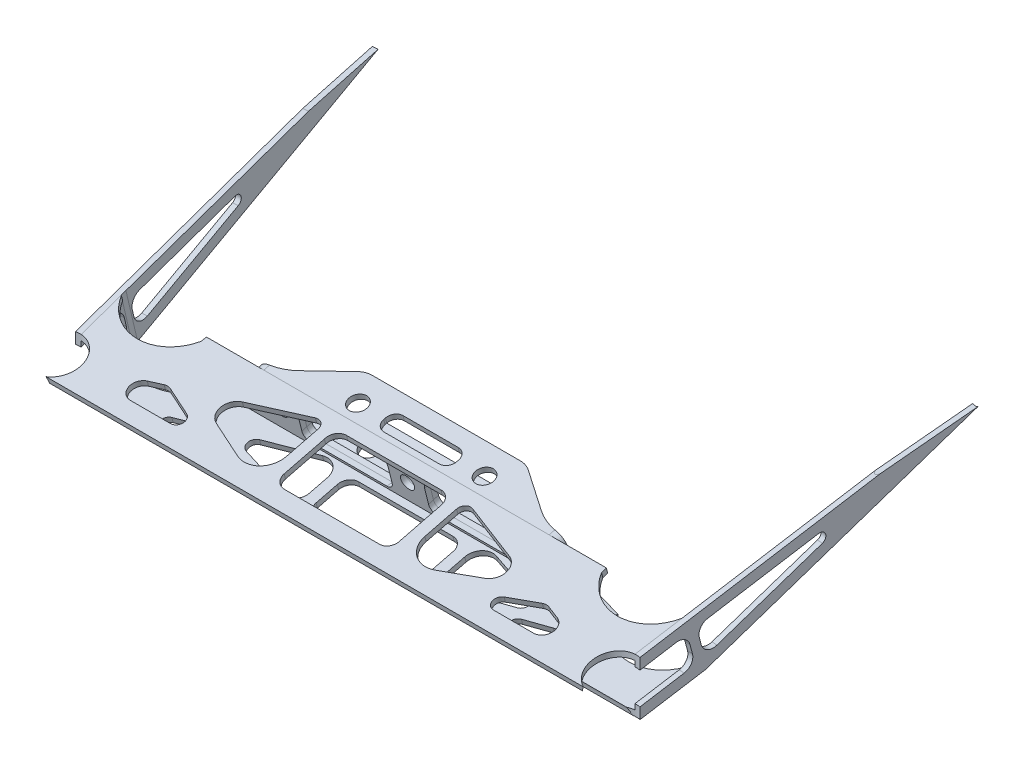
from build123d import *

# Parameters (mm, degrees)
BOSS_EXTRUDE12_DEPTH                       = 175
BOSS_EXTRUDE12_DEPTH_BACK                  = 175
SKETCH1_R                                  = 12.7
SKETCH1_R_2                                = 11.5
CUT_EXTRUDE2_DEPTH                         = 176.919242836
CUT_EXTRUDE2_DEPTH_BACK                    = 176.919242836
BOSS_EXTRUDE13_REACH                       = 284.778
SKETCH18_R                                 = 12.7
SKETCH18_R_2                               = 11.5
BOSS_EXTRUDE14_REACH                       = 556.697
SKETCH20_R                                 = 11.2
SKETCH20_R_2                               = 10
BOSS_EXTRUDE15_REACH                       = 435.706
BOSS_EXTRUDE15_END_RADIUS                  = 12.7
SKETCH21_R                                 = 12.7
SKETCH21_R_2                               = 11.5
BOSS_EXTRUDE15_DIRECTION_2_REACH           = 435.706
BOSS_EXTRUDE15_DIRECTION_2_END_RADIUS      = 12.7
BOSS_EXTRUDEMAINXMEMBER_DEPTH              = 165.85
BOSS_EXTRUDEMAINXMEMBER_DEPTH_BACK         = 165.85
SKETCH46_W                                 = 165.540939551
SKETCH46_H                                 = 112.162432512
CUT_EXTRUDE7_DEPTH                         = 529.248434774
BOSS_EXTRUDELOWERSHOCKMNT_START            = 11.62
SKETCH5_R                                  = 5
BOSS_EXTRUDELOWERSHOCKMNT_DEPTH            = 3
BOSS_EXTRUDEUPPERSHOCKMNT_START            = -11.65
SKETCH5_3_R                                = 5
BOSS_EXTRUDEUPPERSHOCKMNT_DEPTH            = 3
SKETCH40_R                                 = 4.1021
BOSS_EXTRUDEBASESHOCKMNT_DEPTH             = 3
FILLETSHOCKMNT_START                       = -23.714786314
FILLETSHOCKMNT_DEPTH                       = 2.922035421
FILLETSHOCKMNT_START_2                     = -47.109041572
FILLETSHOCKMNT_2_DEPTH                     = 0.124255258
FILLETSHOCKMNT_START_3                     = -20.839041572
FILLETSHOCKMNT_3_DEPTH                     = 0.054370147
FILLETSHOCKMNT_START_4                     = -49.984786314
FILLETSHOCKMNT_4_DEPTH                     = 2.875744742
FILLETSHOCKMNT_START_5                     = -20.784671425
FILLETSHOCKMNT_5_DEPTH                     = 0.069885111
FILLETSHOCKMNT_START_6                     = -20.792750893
FILLETSHOCKMNT_6_DEPTH                     = 0.008079468
FILLETSHOCKMNT_START_7                     = 38.86190522
FILLETSHOCKMNT_7_DEPTH                     = 4.928835609
BOSS_EXTRUDELEFTVERTTUBEGUSSET_DEPTH       = 1.5
CUT_EXTRUDELEFTVERTTUBEGUSSETLIGHTEN_DEPTH = 3
SKETCH20_3_R                               = 11.2
SKETCH20_3_R_2                             = 10
CUT_EXTRUDETRIMXMEMBERU_DEPTH              = 570.182555296
SKETCH18_2_R                               = 12.7
SKETCH18_2_R_2                             = 11.5
CUT_EXTRUDE6_DEPTH                         = 472.005588149
SKETCH26_R                                 = 4.1021
CUT_EXTRUDEXMEMBERREAR_DEPTH               = 3
CUT_EXTRUDEXMEMBERREAR_DRAFT               = -4
CUT_EXTRUDEXMEMBERREAR_PROFILE_2_DEPTH     = 3
CUT_EXTRUDEXMEMBERREAR_PROFILE_2_DRAFT     = -4
CUT_EXTRUDEXMEMBERREAR_PROFILE_3_DEPTH     = 3
CUT_EXTRUDEXMEMBERREAR_PROFILE_3_DRAFT     = -4
CUT_EXTRUDEXMEMBERREAR_PROFILE_4_DEPTH     = 3
CUT_EXTRUDEXMEMBERREAR_PROFILE_4_DRAFT     = -4
CUT_EXTRUDEXMEMBERREAR_PROFILE_5_DEPTH     = 3
CUT_EXTRUDEXMEMBERREAR_PROFILE_5_DRAFT     = -4
CUT_EXTRUDEXMEMBERREAR_PROFILE_6_DEPTH     = 3
CUT_EXTRUDEXMEMBERREAR_PROFILE_6_DRAFT     = -4
CUT_EXTRUDEXMEMBERREAR_PROFILE_7_DEPTH     = 3
CUT_EXTRUDEXMEMBERREAR_PROFILE_7_DRAFT     = -4
CUT_EXTRUDEXMEMBERBOTTOMDIAGS_DEPTH        = 3
CUTEXTRUDEXMEMBERTOPDIAGS_DEPTH            = 3
CUT_EXTRUDEBOTTOMCROSSTUBEFIT_DEPTH        = 263.587706398
CUT_EXTRUDEBOTTOMCROSSTUBEFIT_DEPTH_BACK   = 263.587706398
SKETCH35_R                                 = 12.7


with BuildPart() as part:
    # Sketch1 → Boss-Extrude12 (new, two sides: drawn at the far end of the back side and taken through both)
    with BuildSketch(Plane(origin=(0, 0, 0), x_dir=(0, 0, -1), z_dir=(1, 0, 0)).offset(-BOSS_EXTRUDE12_DEPTH_BACK)):
        Circle(SKETCH1_R)
        Circle(SKETCH1_R_2, mode=Mode.SUBTRACT)
    extrude(amount=BOSS_EXTRUDE12_DEPTH + BOSS_EXTRUDE12_DEPTH_BACK)

    # Sketch17 → Cut-Extrude2 (cut, two sides: drawn at the far end of the back side and taken through both)
    with BuildSketch(Plane.XY.offset(-CUT_EXTRUDE2_DEPTH_BACK)):
        Polygon((168.55, 12.7), (126.783029561, -29.066970439), (201.822655854, -29.066970439), (201.822655854, 12.7), align=None)
        Polygon((-168.55, 12.7), (-126.783029561, -29.066970439), (-201.822655854, -29.066970439), (-201.822655854, 12.7), align=None)
    extrude(amount=CUT_EXTRUDE2_DEPTH + CUT_EXTRUDE2_DEPTH_BACK, mode=Mode.SUBTRACT)

    # Sketch18 → Boss-Extrude13 (add, up to next)
    with BuildSketch(Plane(origin=(0, -214, 0), x_dir=(-1, 0, 0), z_dir=(0, -1, 0)), mode=Mode.PRIVATE) as boss_extrude13_sk1:
        with Locations(Location((-155.85, 0, 0), (0, 0, 180))):
            Circle(SKETCH18_R)
        with Locations(Location((-155.85, 0, 0), (0, 0, 180))):
            Circle(SKETCH18_R_2, mode=Mode.SUBTRACT)
    boss_extrude13_tool1 = extrude(boss_extrude13_sk1.sketch, amount=-BOSS_EXTRUDE13_REACH, mode=Mode.PRIVATE) - part.part
    # Sketch18 → Boss-Extrude13 (add, up to next)
    with BuildSketch(Plane(origin=(0, -214, 0), x_dir=(-1, 0, 0), z_dir=(0, -1, 0)), mode=Mode.PRIVATE) as boss_extrude13_sk2:
        with Locations(Location((155.85, 0, 0), (0, 0, 180))):
            Circle(SKETCH18_R)
        with Locations(Location((155.85, 0, 0), (0, 0, 180))):
            Circle(SKETCH18_R_2, mode=Mode.SUBTRACT)
    boss_extrude13_tool2 = extrude(boss_extrude13_sk2.sketch, amount=-BOSS_EXTRUDE13_REACH, mode=Mode.PRIVATE) - part.part
    add(boss_extrude13_tool1.solids().sort_by_distance((143.50921, -214, 0))[0])
    add(boss_extrude13_tool2.solids().sort_by_distance((-168.19079, -214, 0))[0])

    # Sketch20 → Boss-Extrude14 (add, up to next)
    with BuildSketch(Plane(origin=(180, 57, -323.098711697), x_dir=(0.9973018692485346, -0.012736517833004717, 0.07229635334419354), z_dir=(-0.07340968116659599, -0.17326508598327037, 0.982135544968325)), mode=Mode.PRIVATE) as boss_extrude14_sk1:
        with Locations(Location((0, 0, 0), (0, 0, 41.766987321))):
            Circle(SKETCH20_R)
        with Locations(Location((0, 0, 0), (0, 0, 41.074676503))):
            Circle(SKETCH20_R_2, mode=Mode.SUBTRACT)
    boss_extrude14_tool1 = extrude(boss_extrude14_sk1.sketch, amount=BOSS_EXTRUDE14_REACH, mode=Mode.PRIVATE) - part.part
    boss_extrude14 = boss_extrude14_tool1.solids().sort_by_distance((171.904673, 49.964287, -324.945014))[0]
    add(boss_extrude14)

    # Mirror5: Boss-Extrude14 across plane
    add(boss_extrude14.mirror(Plane(origin=(0, 0, 0), x_dir=(0, 0, 1), z_dir=(1, 0, 0))))

    # Boss-Extrude15: up to this cylinder (the profile starts outside it)
    boss_extrude15_end = Plane(origin=(155.85, -50, 0), z_dir=(0, -1, 0)) * Cylinder(BOSS_EXTRUDE15_END_RADIUS, 897.812, mode=Mode.PRIVATE)
    # Sketch21 → Boss-Extrude15 (add, up to the surface)
    with BuildSketch(Plane(origin=(0, 0, 0), x_dir=(0, 0, -1), z_dir=(1, 0, 0)), mode=Mode.PRIVATE) as boss_extrude15_sk1:
        with Locations((0, -50)):
            Circle(SKETCH21_R)
        with Locations((0, -50)):
            Circle(SKETCH21_R_2, mode=Mode.SUBTRACT)
    boss_extrude15_tool1 = extrude(boss_extrude15_sk1.sketch, amount=BOSS_EXTRUDE15_REACH, mode=Mode.PRIVATE) - boss_extrude15_end
    add(boss_extrude15_tool1.solids().sort_by_distance((0, -50, 12.34079))[0])

    # Boss-Extrude15 direction 2: up to this cylinder (the profile starts outside it)
    boss_extrude15_direction_2_end = Plane(origin=(-155.85, -50, 0), z_dir=(0, -1, 0)) * Cylinder(BOSS_EXTRUDE15_DIRECTION_2_END_RADIUS, 897.812, mode=Mode.PRIVATE)
    # Sketch21 → Boss-Extrude15 direction 2 (add, up to the surface)
    with BuildSketch(Plane(origin=(0, 0, 0), x_dir=(0, 0, -1), z_dir=(1, 0, 0)), mode=Mode.PRIVATE) as boss_extrude15_direction_2_sk1:
        with Locations((0, -50)):
            Circle(SKETCH21_R)
        with Locations((0, -50)):
            Circle(SKETCH21_R_2, mode=Mode.SUBTRACT)
    boss_extrude15_direction_2_tool1 = extrude(boss_extrude15_direction_2_sk1.sketch, amount=-BOSS_EXTRUDE15_DIRECTION_2_REACH, mode=Mode.PRIVATE) - boss_extrude15_direction_2_end
    add(boss_extrude15_direction_2_tool1.solids().sort_by_distance((0, -50, 12.34079))[0])


with BuildPart() as body_2:
    # Sketch2 → Boss-ExtrudeMainXmember (new, two sides: drawn at the far end of the back side and taken through both)
    with BuildSketch(Plane(origin=(0, 0, 0), x_dir=(0, 0, -1), z_dir=(1, 0, 0)).offset(-BOSS_EXTRUDEMAINXMEMBER_DEPTH_BACK)):
        Polygon((46.896325284, -39.85335332), (12.103461131, -48.528188653), (11.377695445, -45.617301474), (43.259672419, -37.668231828), (37.622892251, -15.060341406), (-10.891894063, -27.156436186), (-11.61765975, -24.245549007), (39.808013743, -11.42368854), align=None)
    extrude(amount=BOSS_EXTRUDEMAINXMEMBER_DEPTH + BOSS_EXTRUDEMAINXMEMBER_DEPTH_BACK)

    # Sketch46 → Cut-Extrude7 (cut, through all)
    with BuildSketch(Plane(origin=(154.984133263, 0, 11.584282706), x_dir=(-0.07453703703703697, 0, 0.997218245977148), z_dir=(-0.997218245977148, 0, -0.07453703703703697))):
        with Locations((-33.423089586, -22.597023813)):
            Rectangle(SKETCH46_W, SKETCH46_H)
    cut_extrude7 = extrude(amount=-CUT_EXTRUDE7_DEPTH, mode=Mode.SUBTRACT)

    # Mirror4: Cut-Extrude7 across plane
    add(cut_extrude7.mirror(Plane(origin=(0, 0, 0), x_dir=(0, 0, 1), z_dir=(1, 0, 0))), mode=Mode.SUBTRACT)

    # Sketch42 → Boss-ExtrudeLeftVertTubeGusset (add, symmetric)
    with BuildSketch(Plane(origin=(155.85, 0, 0), x_dir=(-0.07453703703703697, 0, 0.997218245977148), z_dir=(-0.997218245977148, 0, -0.07453703703703697))):
        Polygon((-193.050072711, 23.60587092), (14.485468375, -12.905011308), (4.541982888, -52.675213787), (-47.027143229, -39.85335332), align=None)
    boss_extrudeleftverttubegusset = extrude(amount=BOSS_EXTRUDELEFTVERTTUBEGUSSET_DEPTH, both=True)

    # Sketch45 → Cut-ExtrudeLeftVertTubeGussetLighten (cut)
    with BuildSketch(Plane(origin=(156.479960632, 0, 11.696088262), x_dir=(-0.0745370370370369, 0, 0.997218245977148), z_dir=(-0.997218245977148, 0, -0.0745370370370369))):
        Polygon((0.040031957, -24.219304243), (-345.10927195, 61.596697465), (-328.771481985, 127.306783252), (79.703640812, 25.745802428), (63.365850846, -39.964283359), align=None)
        with BuildLine():
            Line((-10.157134064, -27.867116711), (-43.174427901, -19.657880556))
            ThreePointArc((-43.174427901, -19.657880556), (-47.712381175, -20.337595354), (-50.442979665, -24.025259114))
            Line((-50.442979665, -24.025259114), (-51.729452386, -29.17066619))
            ThreePointArc((-51.729452386, -29.17066619), (-51.051635871, -33.716233033), (-47.356358542, -36.448729806))
            Line((-47.356358542, -36.448729806), (-14.339064705, -44.657965961))
            ThreePointArc((-14.339064705, -44.657965961), (-9.801111431, -43.978251163), (-7.07051294, -40.290587403))
            Line((-7.07051294, -40.290587403), (-5.784040219, -35.145180327))
            ThreePointArc((-5.784040219, -35.145180327), (-6.461856735, -30.599613484), (-10.157134064, -27.867116711))
        make_face()
        with BuildLine():
            Line((-59.679677528, -15.553604453), (-117.816183972, -1.098867098))
            ThreePointArc((-117.816183972, -1.098867098), (-121.381246102, -3.047109834), (-119.73576712, -6.76163762))
            Line((-119.73576712, -6.76163762), (-64.491614129, -30.769860883))
            ThreePointArc((-64.491614129, -30.769860883), (-59.447689366, -30.648891023), (-56.279353988, -26.722383457))
            Line((-56.279353988, -26.722383457), (-55.306583684, -22.83166807))
            ThreePointArc((-55.306583684, -22.83166807), (-55.984400199, -18.286101227), (-59.679677528, -15.553604453))
        make_face()
    cut_extrudeleftverttubegussetlighten = extrude(amount=CUT_EXTRUDELEFTVERTTUBEGUSSETLIGHTEN_DEPTH, mode=Mode.SUBTRACT)

    # Mirror3: Boss-ExtrudeLeftVertTubeGusset across plane
    add(boss_extrudeleftverttubegusset.mirror(Plane(origin=(0, 0, 0), x_dir=(0, 0, 1), z_dir=(1, 0, 0))))

    # Mirror3 2: Cut-ExtrudeLeftVertTubeGussetLighten across plane
    add(cut_extrudeleftverttubegussetlighten.mirror(Plane(origin=(0, 0, 0), x_dir=(0, 0, 1), z_dir=(1, 0, 0))), mode=Mode.SUBTRACT)

    # Sketch20<3> → Cut-ExtrudeTrimXmemberU (cut, through all)
    # profile 1 of 2: a face of its own
    with BuildSketch(Plane(origin=(180, 57, -323.098711697), x_dir=(0.9973018692485346, -0.012736517833004717, 0.07229635334419354), z_dir=(-0.07340968116659599, -0.17326508598327037, 0.982135544968325))):
        with Locations(Location((0, 0, 0), (0, 0, 41.766987321))):
            Circle(SKETCH20_3_R)
        with Locations(Location((0, 0, 0), (0, 0, 41.074676503))):
            Circle(SKETCH20_3_R_2, mode=Mode.SUBTRACT)
    # profile 2 of 2: a face of its own
    with BuildSketch(Plane(origin=(180, 57, -323.098711697), x_dir=(0.9973018692485346, -0.012736517833004717, 0.07229635334419354), z_dir=(-0.07340968116659599, -0.17326508598327037, 0.982135544968325))):
        with Locations((-359.028672929, 0.006280918)):
            Circle(SKETCH20_3_R)
        with Locations((-359.028672929, 0.006280918)):
            Circle(SKETCH20_3_R_2, mode=Mode.SUBTRACT)
    extrude(amount=CUT_EXTRUDETRIMXMEMBERU_DEPTH, mode=Mode.SUBTRACT)

    # Sketch18<2> → Cut-Extrude6 (cut, through all)
    # profile 1 of 2: a face of its own
    with BuildSketch(Plane(origin=(0, -214, 0), x_dir=(-1, 0, 0), z_dir=(0, -1, 0))):
        with Locations(Location((-155.85, 0, 0), (0, 0, 180))):
            Circle(SKETCH18_2_R)
        with Locations(Location((-155.85, 0, 0), (0, 0, 180))):
            Circle(SKETCH18_2_R_2, mode=Mode.SUBTRACT)
    # profile 2 of 2: a face of its own
    with BuildSketch(Plane(origin=(0, -214, 0), x_dir=(-1, 0, 0), z_dir=(0, -1, 0))):
        with Locations(Location((155.85, 0, 0), (0, 0, 180))):
            Circle(SKETCH18_2_R)
        with Locations(Location((155.85, 0, 0), (0, 0, 180))):
            Circle(SKETCH18_2_R_2, mode=Mode.SUBTRACT)
    extrude(amount=-CUT_EXTRUDE6_DEPTH, mode=Mode.SUBTRACT)


with BuildPart() as body_3:
    # Sketch5 → Boss-ExtrudeLowerShockMnt (new body)
    with BuildSketch(Plane(origin=(0, -34.314301021, -8.555516143), x_dir=(-1, 0, 0), z_dir=(0, -0.9702957262759956, -0.24192189559967137)).offset(BOSS_EXTRUDELOWERSHOCKMNT_START)):
        with BuildLine():
            Line((-47.750147405, 57.054665497), (-80, 35.86190522))
            Line((-80, 35.86190522), (80, 35.86190522))
            Line((80, 35.86190522), (47.750147405, 57.054665497))
            ThreePointArc((47.750147405, 57.054665497), (44.861938418, 58.400414674), (41.709190652, 58.86190522))
            Line((41.709190652, 58.86190522), (-41.709190652, 58.86190522))
            ThreePointArc((-41.709190652, 58.86190522), (-44.861938418, 58.400414674), (-47.750147405, 57.054665497))
        make_face()
        with Locations(Location((-35.5, 44.43190522, 0), (0, 0, 270))):
            Circle(SKETCH5_R, mode=Mode.SUBTRACT)
        with Locations(Location((35.5, 44.43190522, 0), (0, 0, 270))):
            Circle(SKETCH5_R, mode=Mode.SUBTRACT)
        with BuildLine():
            Line((-15.5, 38.86190522), (15.5, 38.86190522))
            ThreePointArc((15.5, 38.86190522), (19.035533906, 40.326371314), (20.5, 43.86190522))
            Line((20.5, 43.86190522), (20.5, 44.86190522))
            ThreePointArc((20.5, 44.86190522), (19.035533906, 48.397439126), (15.5, 49.86190522))
            Line((15.5, 49.86190522), (-15.5, 49.86190522))
            ThreePointArc((-15.5, 49.86190522), (-19.035533906, 48.397439126), (-20.5, 44.86190522))
            Line((-20.5, 44.86190522), (-20.5, 43.86190522))
            ThreePointArc((-20.5, 43.86190522), (-19.035533906, 40.326371314), (-15.5, 38.86190522))
        make_face(mode=Mode.SUBTRACT)
    extrude(amount=BOSS_EXTRUDELOWERSHOCKMNT_DEPTH)


with BuildPart() as body_4:
    # Sketch5<3> → Boss-ExtrudeUpperShockMnt (new body)
    with BuildSketch(Plane(origin=(0, -34.314301021, -8.555516143), x_dir=(-1, 0, 0), z_dir=(0, -0.9702957262759956, -0.24192189559967137)).offset(BOSS_EXTRUDEUPPERSHOCKMNT_START)):
        with BuildLine():
            Line((-47.750147405, 57.054665497), (-80, 35.86190522))
            Line((-80, 35.86190522), (80, 35.86190522))
            Line((80, 35.86190522), (47.750147405, 57.054665497))
            ThreePointArc((47.750147405, 57.054665497), (44.861938418, 58.400414674), (41.709190652, 58.86190522))
            Line((41.709190652, 58.86190522), (-41.709190652, 58.86190522))
            ThreePointArc((-41.709190652, 58.86190522), (-44.861938418, 58.400414674), (-47.750147405, 57.054665497))
        make_face()
        with Locations(Location((-35.5, 44.43190522, 0), (0, 0, 90))):
            Circle(SKETCH5_3_R, mode=Mode.SUBTRACT)
        with Locations(Location((35.5, 44.43190522, 0), (0, 0, 90))):
            Circle(SKETCH5_3_R, mode=Mode.SUBTRACT)
        with BuildLine():
            Line((-15.5, 38.86190522), (15.5, 38.86190522))
            ThreePointArc((15.5, 38.86190522), (19.035533906, 40.326371314), (20.5, 43.86190522))
            Line((20.5, 43.86190522), (20.5, 44.86190522))
            ThreePointArc((20.5, 44.86190522), (19.035533906, 48.397439126), (15.5, 49.86190522))
            Line((15.5, 49.86190522), (-15.5, 49.86190522))
            ThreePointArc((-15.5, 49.86190522), (-19.035533906, 48.397439126), (-20.5, 44.86190522))
            Line((-20.5, 44.86190522), (-20.5, 43.86190522))
            ThreePointArc((-20.5, 43.86190522), (-19.035533906, 40.326371314), (-15.5, 38.86190522))
        make_face(mode=Mode.SUBTRACT)
    extrude(amount=-BOSS_EXTRUDEUPPERSHOCKMNT_DEPTH)


    add(body_3.part)  # Boss-ExtrudeBaseShockMnt merges body 3
    # Sketch40 → Boss-ExtrudeBaseShockMnt (add)
    with BuildSketch(Plane(origin=(0, 8.675780091, -34.796653371), x_dir=(-1, 0, 0), z_dir=(0, 0.24192189559967078, -0.9702957262759958))):
        with BuildLine():
            Line((-86, -26.714786314), (-86, -44.014786314))
            ThreePointArc((-86, -44.014786314), (-84.242640687, -48.257427001), (-80, -50.014786314))
            Line((-80, -50.014786314), (80, -50.014786314))
            ThreePointArc((80, -50.014786314), (84.242640687, -48.257427001), (86, -44.014786314))
            Line((86, -44.014786314), (86, -26.714786314))
            ThreePointArc((86, -26.714786314), (84.242640687, -22.472145627), (80, -20.714786314))
            Line((80, -20.714786314), (-80, -20.714786314))
            ThreePointArc((-80, -20.714786314), (-84.242640687, -22.472145627), (-86, -26.714786314))
        make_face()
        with Locations(Location((-71, -35.364786314, 0), (0, 0, 90))):
            Circle(SKETCH40_R, mode=Mode.SUBTRACT)
        with Locations(Location((0, -35.364786314, 0), (0, 0, 90))):
            Circle(SKETCH40_R, mode=Mode.SUBTRACT)
        with Locations(Location((71, -35.364786314, 0), (0, 0, 270))):
            Circle(SKETCH40_R, mode=Mode.SUBTRACT)
        with BuildLine():
            Line((-57, -24.864786314), (-18, -24.864786314))
            ThreePointArc((-18, -24.864786314), (-12.343145751, -27.207932064), (-10, -32.864786314))
            Line((-10, -32.864786314), (-10, -41.864786314))
            ThreePointArc((-10, -41.864786314), (-11.171572875, -44.693213439), (-14, -45.864786314))
            Line((-14, -45.864786314), (-57, -45.864786314))
            ThreePointArc((-57, -45.864786314), (-59.828427125, -44.693213439), (-61, -41.864786314))
            Line((-61, -41.864786314), (-61, -28.864786314))
            ThreePointArc((-61, -28.864786314), (-59.828427125, -26.036359189), (-57, -24.864786314))
        make_face(mode=Mode.SUBTRACT)
        with BuildLine():
            Line((10, -32.864786314), (10, -41.864786314))
            ThreePointArc((10, -41.864786314), (11.171572875, -44.693213439), (14, -45.864786314))
            Line((14, -45.864786314), (57, -45.864786314))
            ThreePointArc((57, -45.864786314), (59.828427125, -44.693213439), (61, -41.864786314))
            Line((61, -41.864786314), (61, -28.864786314))
            ThreePointArc((61, -28.864786314), (59.828427125, -26.036359189), (57, -24.864786314))
            Line((57, -24.864786314), (18, -24.864786314))
            ThreePointArc((18, -24.864786314), (12.343145751, -27.207932064), (10, -32.864786314))
        make_face(mode=Mode.SUBTRACT)
    extrude(amount=BOSS_EXTRUDEBASESHOCKMNT_DEPTH)

    # FilletShockMnt: read off the stored shape, not the designer's step
    # FilletShockMnt outline → FilletShockMnt (add)
    with BuildSketch(Plane(origin=(0, 0, 0), x_dir=(1, 0, 0), z_dir=(0, 0.9702957262759958, 0.24192189559967095)).offset(FILLETSHOCKMNT_START)):
        with BuildLine():
            Line((-75.434782609, 38.86190522), (-67.934380595, 43.790740829))
            ThreePointArc((-67.934380595, 43.790740829), (-75.811314196, 40.120515799), (-84.409717195, 38.86190522))
            Line((-84.409717195, 38.86190522), (-75.434782609, 38.86190522))
        make_face()
        with BuildLine():
            Line((67.934380595, 43.790740829), (75.434782609, 38.86190522))
            Line((75.434782609, 38.86190522), (84.409717195, 38.86190522))
            ThreePointArc((84.409717195, 38.86190522), (75.811314196, 40.120515799), (67.934380595, 43.790740829))
        make_face()
    extrude(amount=FILLETSHOCKMNT_DEPTH)

    # FilletShockMnt 2 outline → FilletShockMnt 2 (add)
    with BuildSketch(Plane(origin=(0, 0, 0), x_dir=(1, 0, 0), z_dir=(0, 0.9702957262759958, 0.24192189559967095)).offset(FILLETSHOCKMNT_START_2)):
        with BuildLine():
            Line((-75.434782609, 38.86190522), (-67.934380595, 43.790740829))
            ThreePointArc((-67.934380595, 43.790740829), (-75.811314196, 40.120515799), (-84.409717195, 38.86190522))
            Line((-84.409717195, 38.86190522), (-75.434782609, 38.86190522))
        make_face()
        with BuildLine():
            Line((67.934380595, 43.790740829), (75.434782609, 38.86190522))
            Line((75.434782609, 38.86190522), (84.409717195, 38.86190522))
            ThreePointArc((84.409717195, 38.86190522), (75.811314196, 40.120515799), (67.934380595, 43.790740829))
        make_face()
    extrude(amount=FILLETSHOCKMNT_2_DEPTH)

    # FilletShockMnt 3 outline → FilletShockMnt 3 (add)
    with BuildSketch(Plane(origin=(0, 0, 0), x_dir=(1, 0, 0), z_dir=(0, 0.9702957262759958, 0.24192189559967095)).offset(FILLETSHOCKMNT_START_3)):
        with BuildLine():
            Line((67.934380595, 43.790740829), (75.434782609, 38.86190522))
            Line((75.434782609, 38.86190522), (84.409717195, 38.86190522))
            ThreePointArc((84.409717195, 38.86190522), (75.811314196, 40.120515799), (67.934380595, 43.790740829))
        make_face()
    extrude(amount=FILLETSHOCKMNT_3_DEPTH)

    # FilletShockMnt 4 outline → FilletShockMnt 4 (add)
    with BuildSketch(Plane(origin=(0, 0, 0), x_dir=(1, 0, 0), z_dir=(0, 0.9702957262759958, 0.24192189559967095)).offset(FILLETSHOCKMNT_START_4)):
        with BuildLine():
            Line((-75.434782609, 38.86190522), (-67.934380595, 43.790740829))
            ThreePointArc((-67.934380595, 43.790740829), (-75.811314196, 40.120515799), (-84.409717195, 38.86190522))
            Line((-84.409717195, 38.86190522), (-75.434782609, 38.86190522))
        make_face()
        with BuildLine():
            ThreePointArc((84.409717195, 38.86190522), (75.811314196, 40.120515799), (67.934380595, 43.790740829))
            Line((67.934380595, 43.790740829), (75.434782609, 38.86190522))
            Line((75.434782609, 38.86190522), (84.409717195, 38.86190522))
        make_face()
    extrude(amount=FILLETSHOCKMNT_4_DEPTH)

    # FilletShockMnt 5 outline → FilletShockMnt 5 (add)
    with BuildSketch(Plane(origin=(0, 0, 0), x_dir=(1, 0, 0), z_dir=(0, 0.9702957262759958, 0.24192189559967095)).offset(FILLETSHOCKMNT_START_5)):
        with BuildLine():
            Line((-75.434782609, 38.86190522), (-67.934380595, 43.790740829))
            ThreePointArc((-67.934380595, 43.790740829), (-75.811314196, 40.120515799), (-84.409717195, 38.86190522))
            Line((-84.409717195, 38.86190522), (-75.434782609, 38.86190522))
        make_face()
        with BuildLine():
            ThreePointArc((84.409717195, 38.86190522), (75.811314196, 40.120515799), (67.934380595, 43.790740829))
            Line((67.934380595, 43.790740829), (75.434782609, 38.86190522))
            Line((75.434782609, 38.86190522), (84.409717195, 38.86190522))
        make_face()
    extrude(amount=FILLETSHOCKMNT_5_DEPTH)

    # FilletShockMnt 6 outline → FilletShockMnt 6 (add)
    with BuildSketch(Plane(origin=(0, 0, 0), x_dir=(1, 0, 0), z_dir=(0, 0.9702957262759958, 0.24192189559967095)).offset(FILLETSHOCKMNT_START_6)):
        with BuildLine():
            Line((-75.434782609, 38.86190522), (-67.934380595, 43.790740829))
            ThreePointArc((-67.934380595, 43.790740829), (-75.811314196, 40.120515799), (-84.409717195, 38.86190522))
            Line((-84.409717195, 38.86190522), (-75.434782609, 38.86190522))
        make_face()
    extrude(amount=FILLETSHOCKMNT_6_DEPTH)

    # FilletShockMnt 7 outline → FilletShockMnt 7 (cut)
    with BuildSketch(Plane(origin=(0, 0, 0), x_dir=(1, 0, 0), z_dir=(0, 0.24192189559967095, -0.9702957262759958)).offset(FILLETSHOCKMNT_START_7)):
        with BuildLine():
            ThreePointArc((84.409717195, 22.64607715), (82.407046428, 21.218776171), (80, 20.714786314))
            Line((80, 20.714786314), (84.409717195, 20.714786314))
            Line((84.409717195, 20.714786314), (84.409717195, 22.64607715))
        make_face()
        with BuildLine():
            Line((84.409717195, 49.984786314), (80.599249529, 49.984786314))
            ThreePointArc((80.599249529, 49.984786314), (82.678836244, 49.383569824), (84.409717195, 48.083495478))
            Line((84.409717195, 48.083495478), (84.409717195, 49.984786314))
        make_face()
        with BuildLine():
            Line((-80.599249529, 49.984786314), (-84.409717195, 49.984786314))
            Line((-84.409717195, 49.984786314), (-84.409717195, 48.083495478))
            ThreePointArc((-84.409717195, 48.083495478), (-82.678836244, 49.383569824), (-80.599249529, 49.984786314))
        make_face()
        with BuildLine():
            ThreePointArc((-80, 20.714786314), (-82.407046428, 21.218776171), (-84.409717195, 22.64607715))
            Line((-84.409717195, 22.64607715), (-84.409717195, 20.714786314))
            Line((-84.409717195, 20.714786314), (-80, 20.714786314))
        make_face()
    extrude(amount=FILLETSHOCKMNT_7_DEPTH, mode=Mode.SUBTRACT)


with BuildPart() as cut_extrude6_kept_piece:
    # of the separate pieces the step leaves, the one the design keeps (cut_extrude6_pieces_kept)
    add(body_2.part.solids().sort_by_distance((-157.851079646, -39.85335332, -46.896325284))[0])


with BuildPart() as cut_extrudexmemberrear_tool:
    # Sketch26 → Cut-ExtrudeXmemberRear (with draft: the straight prism first)
    with BuildSketch(Plane(origin=(0, 8.675780091, -34.796653371), x_dir=(-1, 0, 0), z_dir=(0, 0.24192189559967056, -0.9702957262759958))):
        with Locations(Location((71, -35.364786314, 0), (0, 0, 270))):
            Circle(SKETCH26_R)
    extrude(amount=-CUT_EXTRUDEXMEMBERREAR_DEPTH)
    # Cut-ExtrudeXmemberRear: the draft: its side faces are tilted about the plane it starts from
    cut_extrudexmemberrear_sides = [cut_extrudexmemberrear_tool.faces().sort_by_distance(p)[0] for p in [
        (-71, -22.021153675, -40.904338116),
    ]]
    draft(cut_extrudexmemberrear_sides, Plane(origin=(0, 8.675780091, -34.796653371), x_dir=(-1, 0, 0), z_dir=(0, 0.24192189559967056, -0.9702957262759958)), CUT_EXTRUDEXMEMBERREAR_DRAFT)


with BuildPart() as cut_extrude6_kept_piece_1:
    add(cut_extrude6_kept_piece.part)

    # Cut-ExtrudeXmemberRear: cut by cut_extrudexmemberrear_tool
    add(cut_extrudexmemberrear_tool.part, mode=Mode.SUBTRACT)


with BuildPart() as cut_extrudexmemberrear_profile_2_tool:
    # Sketch26 → Cut-ExtrudeXmemberRear profile 2 (with draft: the straight prism first)
    with BuildSketch(Plane(origin=(0, 8.675780091, -34.796653371), x_dir=(-1, 0, 0), z_dir=(0, 0.24192189559967056, -0.9702957262759958))):
        with Locations(Location((-71, -35.364786314, 0), (0, 0, 90))):
            Circle(SKETCH26_R)
    extrude(amount=-CUT_EXTRUDEXMEMBERREAR_PROFILE_2_DEPTH)
    # Cut-ExtrudeXmemberRear profile 2: the draft: its side faces are tilted about the plane it starts from
    cut_extrudexmemberrear_profile_2_sides = [cut_extrudexmemberrear_profile_2_tool.faces().sort_by_distance(p)[0] for p in [
        (71, -29.981653872, -42.889113732),
    ]]
    draft(cut_extrudexmemberrear_profile_2_sides, Plane(origin=(0, 8.675780091, -34.796653371), x_dir=(-1, 0, 0), z_dir=(0, 0.24192189559967056, -0.9702957262759958)), CUT_EXTRUDEXMEMBERREAR_PROFILE_2_DRAFT)


with BuildPart() as cut_extrude6_kept_piece_2:
    add(cut_extrude6_kept_piece_1.part)

    # Cut-ExtrudeXmemberRear profile 2: cut by cut_extrudexmemberrear_profile_2_tool
    add(cut_extrudexmemberrear_profile_2_tool.part, mode=Mode.SUBTRACT)


with BuildPart() as cut_extrudexmemberrear_profile_3_tool:
    # Sketch26 → Cut-ExtrudeXmemberRear profile 3 (with draft: the straight prism first)
    with BuildSketch(Plane(origin=(0, 8.675780091, -34.796653371), x_dir=(-1, 0, 0), z_dir=(0, 0.24192189559967056, -0.9702957262759958))):
        with Locations(Location((0, -35.364786314, 0), (0, 0, 90))):
            Circle(SKETCH26_R)
    extrude(amount=-CUT_EXTRUDEXMEMBERREAR_PROFILE_3_DEPTH)
    # Cut-ExtrudeXmemberRear profile 3: the draft: its side faces are tilted about the plane it starts from
    cut_extrudexmemberrear_profile_3_sides = [cut_extrudexmemberrear_profile_3_tool.faces().sort_by_distance(p)[0] for p in [
        (0, -29.981653872, -42.889113732),
    ]]
    draft(cut_extrudexmemberrear_profile_3_sides, Plane(origin=(0, 8.675780091, -34.796653371), x_dir=(-1, 0, 0), z_dir=(0, 0.24192189559967056, -0.9702957262759958)), CUT_EXTRUDEXMEMBERREAR_PROFILE_3_DRAFT)


with BuildPart() as cut_extrude6_kept_piece_3:
    add(cut_extrude6_kept_piece_2.part)

    # Cut-ExtrudeXmemberRear profile 3: cut by cut_extrudexmemberrear_profile_3_tool
    add(cut_extrudexmemberrear_profile_3_tool.part, mode=Mode.SUBTRACT)


with BuildPart() as cut_extrudexmemberrear_profile_4_tool:
    # Sketch26 → Cut-ExtrudeXmemberRear profile 4 (with draft: the straight prism first)
    with BuildSketch(Plane(origin=(0, 8.675780091, -34.796653371), x_dir=(-1, 0, 0), z_dir=(0, 0.24192189559967056, -0.9702957262759958))):
        with BuildLine():
            Line((157.283581071, -18.630830084), (112.091524494, -18.630830084))
            Line((112.091524494, -18.630830084), (112.091524494, -23.714786314))
            Line((112.091524494, -23.714786314), (104.254051925, -28.560195078))
            ThreePointArc((104.254051925, -28.560195078), (100.460896123, -35.364786314), (104.254051925, -42.16937755))
            Line((104.254051925, -42.16937755), (112.091524494, -47.014786314))
            Line((112.091524494, -47.014786314), (112.091524494, -50.014786314))
            Line((112.091524494, -50.014786314), (157.851079646, -50.014786314))
            Line((157.851079646, -50.014786314), (157.283581071, -18.630830084))
        make_face()
    extrude(amount=-CUT_EXTRUDEXMEMBERREAR_PROFILE_4_DEPTH)
    # Cut-ExtrudeXmemberRear profile 4: the draft: its side faces are tilted about the plane it starts from
    cut_extrudexmemberrear_profile_4_sides = [cut_extrudexmemberrear_profile_4_tool.faces().sort_by_distance(p)[0] for p in [
        (-134.687552783, -9.764517561, -37.848415512),
        (-112.091524494, -12.230988062, -38.463375676),
        (-108.17278821, -17.04819827, -39.664441077),
        (-100.460896123, -26.001403774, -41.896725924),
        (-108.17278821, -34.954609277, -44.129010771),
        (-112.091524494, -38.760792574, -45.077998851),
        (-134.97130207, -40.216236164, -45.440881695),
        (-157.567330359, -24.990376862, -41.644648604),
    ]]
    draft(cut_extrudexmemberrear_profile_4_sides, Plane(origin=(0, 8.675780091, -34.796653371), x_dir=(-1, 0, 0), z_dir=(0, 0.24192189559967056, -0.9702957262759958)), CUT_EXTRUDEXMEMBERREAR_PROFILE_4_DRAFT)


with BuildPart() as cut_extrude6_kept_piece_4:
    add(cut_extrude6_kept_piece_3.part)

    # Cut-ExtrudeXmemberRear profile 4: cut by cut_extrudexmemberrear_profile_4_tool
    add(cut_extrudexmemberrear_profile_4_tool.part, mode=Mode.SUBTRACT)


with BuildPart() as cut_extrudexmemberrear_profile_5_tool:
    # Sketch26 → Cut-ExtrudeXmemberRear profile 5 (with draft: the straight prism first)
    with BuildSketch(Plane(origin=(0, 8.675780091, -34.796653371), x_dir=(-1, 0, 0), z_dir=(0, 0.24192189559967056, -0.9702957262759958))):
        with BuildLine():
            ThreePointArc((61, -28.864786314), (59.828427125, -26.036359189), (57, -24.864786314))
            Line((57, -24.864786314), (18, -24.864786314))
            ThreePointArc((18, -24.864786314), (12.343145751, -27.207932064), (10, -32.864786314))
            Line((10, -32.864786314), (10, -41.864786314))
            ThreePointArc((10, -41.864786314), (11.171572875, -44.693213439), (14, -45.864786314))
            Line((14, -45.864786314), (57, -45.864786314))
            ThreePointArc((57, -45.864786314), (59.828427125, -44.693213439), (61, -41.864786314))
            Line((61, -41.864786314), (61, -28.864786314))
        make_face()
    extrude(amount=-CUT_EXTRUDEXMEMBERREAR_PROFILE_5_DEPTH)
    # Cut-ExtrudeXmemberRear profile 5: the draft: its side faces are tilted about the plane it starts from
    cut_extrudexmemberrear_profile_5_sides = [cut_extrudexmemberrear_profile_5_tool.faces().sort_by_distance(p)[0] for p in [
        (-59.828427125, -16.950070802, -39.639975151),
        (-37.5, -15.813298648, -39.35654602),
        (-12.343145751, -18.086842956, -39.923404282),
        (-10, -27.941995226, -42.380569715),
        (-11.171572875, -35.052736746, -44.153476697),
        (-35.5, -36.1895089, -44.436905828),
        (-59.828427125, -35.052736746, -44.153476697),
        (-61, -26.001403774, -41.896725924),
    ]]
    draft(cut_extrudexmemberrear_profile_5_sides, Plane(origin=(0, 8.675780091, -34.796653371), x_dir=(-1, 0, 0), z_dir=(0, 0.24192189559967056, -0.9702957262759958)), CUT_EXTRUDEXMEMBERREAR_PROFILE_5_DRAFT)


with BuildPart() as cut_extrude6_kept_piece_5:
    add(cut_extrude6_kept_piece_4.part)

    # Cut-ExtrudeXmemberRear profile 5: cut by cut_extrudexmemberrear_profile_5_tool
    add(cut_extrudexmemberrear_profile_5_tool.part, mode=Mode.SUBTRACT)


with BuildPart() as cut_extrudexmemberrear_profile_6_tool:
    # Sketch26 → Cut-ExtrudeXmemberRear profile 6 (with draft: the straight prism first)
    with BuildSketch(Plane(origin=(0, 8.675780091, -34.796653371), x_dir=(-1, 0, 0), z_dir=(0, 0.24192189559967056, -0.9702957262759958))):
        with BuildLine():
            ThreePointArc((-57, -24.864786314), (-59.828427125, -26.036359189), (-61, -28.864786314))
            Line((-61, -28.864786314), (-61, -41.864786314))
            ThreePointArc((-61, -41.864786314), (-59.828427125, -44.693213439), (-57, -45.864786314))
            Line((-57, -45.864786314), (-14, -45.864786314))
            ThreePointArc((-14, -45.864786314), (-11.171572875, -44.693213439), (-10, -41.864786314))
            Line((-10, -41.864786314), (-10, -32.864786314))
            ThreePointArc((-10, -32.864786314), (-12.343145751, -27.207932064), (-18, -24.864786314))
            Line((-18, -24.864786314), (-57, -24.864786314))
        make_face()
    extrude(amount=-CUT_EXTRUDEXMEMBERREAR_PROFILE_6_DEPTH)
    # Cut-ExtrudeXmemberRear profile 6: the draft: its side faces are tilted about the plane it starts from
    cut_extrudexmemberrear_profile_6_sides = [cut_extrudexmemberrear_profile_6_tool.faces().sort_by_distance(p)[0] for p in [
        (59.828427125, -16.950070802, -39.639975151),
        (61, -26.001403774, -41.896725924),
        (59.828427125, -35.052736746, -44.153476697),
        (35.5, -36.1895089, -44.436905828),
        (11.171572875, -35.052736746, -44.153476697),
        (10, -27.941995226, -42.380569715),
        (12.343145751, -18.086842956, -39.923404282),
        (37.5, -15.813298648, -39.35654602),
    ]]
    draft(cut_extrudexmemberrear_profile_6_sides, Plane(origin=(0, 8.675780091, -34.796653371), x_dir=(-1, 0, 0), z_dir=(0, 0.24192189559967056, -0.9702957262759958)), CUT_EXTRUDEXMEMBERREAR_PROFILE_6_DRAFT)


with BuildPart() as cut_extrude6_kept_piece_6:
    add(cut_extrude6_kept_piece_5.part)

    # Cut-ExtrudeXmemberRear profile 6: cut by cut_extrudexmemberrear_profile_6_tool
    add(cut_extrudexmemberrear_profile_6_tool.part, mode=Mode.SUBTRACT)


with BuildPart() as cut_extrudexmemberrear_profile_7_tool:
    # Sketch26 → Cut-ExtrudeXmemberRear profile 7 (with draft: the straight prism first)
    with BuildSketch(Plane(origin=(0, 8.675780091, -34.796653371), x_dir=(-1, 0, 0), z_dir=(0, 0.24192189559967056, -0.9702957262759958))):
        with BuildLine():
            Line((-112.091524494, -23.714786314), (-112.091524494, -18.630830084))
            Line((-112.091524494, -18.630830084), (-157.283581071, -18.630830084))
            Line((-157.283581071, -18.630830084), (-157.851079646, -50.014786314))
            Line((-157.851079646, -50.014786314), (-112.091524494, -50.014786314))
            Line((-112.091524494, -50.014786314), (-112.091524494, -47.014786314))
            Line((-112.091524494, -47.014786314), (-104.254051925, -42.16937755))
            ThreePointArc((-104.254051925, -42.16937755), (-100.460896123, -35.364786314), (-104.254051925, -28.560195078))
            Line((-104.254051925, -28.560195078), (-112.091524494, -23.714786314))
        make_face()
    extrude(amount=-CUT_EXTRUDEXMEMBERREAR_PROFILE_7_DEPTH)
    # Cut-ExtrudeXmemberRear profile 7: the draft: its side faces are tilted about the plane it starts from
    cut_extrudexmemberrear_profile_7_sides = [cut_extrudexmemberrear_profile_7_tool.faces().sort_by_distance(p)[0] for p in [
        (108.17278821, -17.04819827, -39.664441077),
        (112.091524494, -12.230988062, -38.463375676),
        (134.687552783, -9.764517561, -37.848415512),
        (157.567330359, -24.990376862, -41.644648604),
        (134.97130207, -40.216236164, -45.440881695),
        (112.091524494, -38.760792574, -45.077998851),
        (108.17278821, -34.954609277, -44.129010771),
        (100.460896123, -26.001403774, -41.896725924),
    ]]
    draft(cut_extrudexmemberrear_profile_7_sides, Plane(origin=(0, 8.675780091, -34.796653371), x_dir=(-1, 0, 0), z_dir=(0, 0.24192189559967056, -0.9702957262759958)), CUT_EXTRUDEXMEMBERREAR_PROFILE_7_DRAFT)


with BuildPart() as cut_extrude6_kept_piece_7:
    add(cut_extrude6_kept_piece_6.part)

    # Cut-ExtrudeXmemberRear profile 7: cut by cut_extrudexmemberrear_profile_7_tool
    add(cut_extrudexmemberrear_profile_7_tool.part, mode=Mode.SUBTRACT)

    # Sketch37 → Cut-ExtrudeXmemberBottomDiags (cut)
    with BuildSketch(Plane(origin=(0, -48.529133411, -12.099671913), x_dir=(1, 0, 0), z_dir=(0, -0.9702957262759958, -0.24192189559967078))):
        with BuildLine():
            Line((-32.5, -10.60390522), (-32.5, -13.62927648))
            Line((-32.5, -13.62927648), (-32.5, -22.86190522))
            ThreePointArc((-32.5, -22.86190522), (-30.742640687, -27.104545907), (-26.5, -28.86190522))
            Line((-26.5, -28.86190522), (-20.577684022, -28.86190522))
            Line((-20.577684022, -28.86190522), (0, -28.86190522))
            Line((0, -28.86190522), (20.577684022, -28.86190522))
            Line((20.577684022, -28.86190522), (26.5, -28.86190522))
            ThreePointArc((26.5, -28.86190522), (30.742640687, -27.104545907), (32.5, -22.86190522))
            Line((32.5, -22.86190522), (32.5, -13.62927648))
            Line((32.5, -13.62927648), (32.5, -10.60390522))
            ThreePointArc((32.5, -10.60390522), (30.742640687, -6.361264533), (26.5, -4.60390522))
            Line((26.5, -4.60390522), (-26.5, -4.60390522))
            ThreePointArc((-26.5, -4.60390522), (-30.742640687, -6.361264533), (-32.5, -10.60390522))
        make_face()
        with BuildLine():
            Line((-112.091524494, -32.86190522), (-112.091524494, -58.607156037))
            Line((-112.091524494, -58.607156037), (-157.157937273, -58.607156037))
            Line((-157.157937273, -58.607156037), (-157.157937273, -32.86190522))
            ThreePointArc((-157.157937273, -32.86190522), (-134.624730884, -19.184303005), (-112.091524494, -32.86190522))
        make_face()
        with BuildLine():
            Line((-113.069380439, -3.60390522), (-82.815286139, -3.60390522))
            ThreePointArc((-82.815286139, -3.60390522), (-78.850028623, -7.077851206), (-81.772316324, -11.465538807))
            Line((-81.772316324, -11.465538807), (-96.013571872, -15.311890187))
            ThreePointArc((-96.013571872, -15.311890187), (-98.753396912, -15.656929685), (-101.483125496, -15.239466675))
            Line((-101.483125496, -15.239466675), (-114.214232073, -11.436569403))
            ThreePointArc((-114.214232073, -11.436569403), (-117.027325406, -7.025397109), (-113.069380439, -3.60390522))
        make_face()
        with BuildLine():
            Line((-38.5, -12.792981973), (-38.5, -23.31414256))
            ThreePointArc((-38.5, -23.31414256), (-41.720754565, -29.729656029), (-48.789703267, -30.979470925))
            Line((-48.789703267, -30.979470925), (-76.174139676, -22.799490821))
            ThreePointArc((-76.174139676, -22.799490821), (-79.028937429, -18.913866438), (-76.072257858, -15.105193051))
            Line((-76.072257858, -15.105193051), (-46.064454724, -7.000531592))
            ThreePointArc((-46.064454724, -7.000531592), (-40.852173821, -8.029226714), (-38.5, -12.792981973))
        make_face()
        with BuildLine():
            Line((157.157937273, -58.607156037), (157.157937273, -32.86190522))
            ThreePointArc((157.157937273, -32.86190522), (134.624730884, -19.184303005), (112.091524494, -32.86190522))
            Line((112.091524494, -32.86190522), (112.091524494, -58.607156037))
            Line((112.091524494, -58.607156037), (157.157937273, -58.607156037))
        make_face()
        with BuildLine():
            Line((76.072257858, -15.105193051), (46.064454724, -7.000531592))
            ThreePointArc((46.064454724, -7.000531592), (40.852173821, -8.029226714), (38.5, -12.792981973))
            Line((38.5, -12.792981973), (38.5, -23.31414256))
            ThreePointArc((38.5, -23.31414256), (41.720754565, -29.729656029), (48.789703267, -30.979470925))
            Line((48.789703267, -30.979470925), (76.174139676, -22.799490821))
            ThreePointArc((76.174139676, -22.799490821), (79.028937429, -18.913866438), (76.072257858, -15.105193051))
        make_face()
        with BuildLine():
            Line((101.483125496, -15.239466675), (114.214232073, -11.436569403))
            ThreePointArc((114.214232073, -11.436569403), (117.027325406, -7.025397109), (113.069380439, -3.60390522))
            Line((113.069380439, -3.60390522), (82.815286139, -3.60390522))
            ThreePointArc((82.815286139, -3.60390522), (78.850028623, -7.077851206), (81.772316324, -11.465538807))
            Line((81.772316324, -11.465538807), (96.013571872, -15.311890187))
            ThreePointArc((96.013571872, -15.311890187), (98.753396912, -15.656929685), (101.483125496, -15.239466675))
        make_face()
    extrude(amount=-CUT_EXTRUDEXMEMBERBOTTOMDIAGS_DEPTH, mode=Mode.SUBTRACT)

    # Sketch36 → CutExtrudeXmemberTopDiags (cut)
    with BuildSketch(Plane(origin=(0, -20.099468631, -5.011360372), x_dir=(1, 0, 0), z_dir=(0, 0.9702957262759959, 0.24192189559966995))):
        with BuildLine():
            Line((113.045696258, -7.13809478), (90.522633491, -7.13809478))
            ThreePointArc((90.522633491, -7.13809478), (86.598648115, -3.914199649), (88.999921412, 0.560735836))
            Line((88.999921412, 0.560735836), (104.320036173, 6.86762745))
            ThreePointArc((104.320036173, 6.86762745), (106.06847833, 7.241687717), (107.83673505, 6.976660869))
            Line((107.83673505, 6.976660869), (114.981666792, 4.540991246))
            ThreePointArc((114.981666792, 4.540991246), (118.964924086, -2.11928891), (113.045696258, -7.13809478))
        make_face()
        with BuildLine():
            Line((38.829807306, 6.475552835), (38.829807306, 24.86190522))
            ThreePointArc((38.829807306, 24.86190522), (40.501995897, 28.114795326), (44.120454329, 28.647962571))
            Line((44.120454329, 28.647962571), (74.832510881, 18.178384149))
            ThreePointArc((74.832510881, 18.178384149), (80.118000964, 11.029178071), (75.285551859, 3.566270553))
            Line((75.285551859, 3.566270553), (55.397943542, -4.620939013))
            ThreePointArc((55.397943542, -4.620939013), (44.152144348, -3.49484422), (38.829807306, 6.475552835))
        make_face()
        with BuildLine():
            Line((-75.285551859, 3.566270553), (-55.397943542, -4.620939013))
            ThreePointArc((-55.397943542, -4.620939013), (-44.152144348, -3.49484422), (-38.829807306, 6.475552835))
            Line((-38.829807306, 6.475552835), (-38.829807306, 24.86190522))
            ThreePointArc((-38.829807306, 24.86190522), (-40.501995897, 28.114795326), (-44.120454329, 28.647962571))
            Line((-44.120454329, 28.647962571), (-74.832510881, 18.178384149))
            ThreePointArc((-74.832510881, 18.178384149), (-80.118000964, 11.029178071), (-75.285551859, 3.566270553))
        make_face()
        with BuildLine():
            Line((-107.83673505, 6.976660869), (-114.981666792, 4.540991246))
            ThreePointArc((-114.981666792, 4.540991246), (-118.964924086, -2.11928891), (-113.045696258, -7.13809478))
            Line((-113.045696258, -7.13809478), (-90.522633491, -7.13809478))
            ThreePointArc((-90.522633491, -7.13809478), (-86.598648115, -3.914199649), (-88.999921412, 0.560735836))
            Line((-88.999921412, 0.560735836), (-104.320036173, 6.86762745))
            ThreePointArc((-104.320036173, 6.86762745), (-106.06847833, 7.241687717), (-107.83673505, 6.976660869))
        make_face()
        with BuildLine():
            Line((-156.955351523, 32.86190522), (-156.955351523, 56.720756135))
            Line((-156.955351523, 56.720756135), (-112.30130493, 56.720756135))
            Line((-112.30130493, 56.720756135), (-112.30130493, 32.86190522))
            ThreePointArc((-112.30130493, 32.86190522), (-134.628328227, 19.109306285), (-156.955351523, 32.86190522))
        make_face()
        with BuildLine():
            Line((32.170192694, -1.62566286), (32.170192694, 22.86190522))
            ThreePointArc((32.170192694, 22.86190522), (30.412833381, 27.104545907), (26.170192694, 28.86190522))
            Line((26.170192694, 28.86190522), (0, 28.86190522))
            Line((0, 28.86190522), (-26.860276463, 28.86190522))
            ThreePointArc((-26.860276463, 28.86190522), (-31.31131181, 26.885371927), (-32.829807306, 22.258))
            Line((-32.829807306, 22.258), (-32.829807306, -0.966048248))
            ThreePointArc((-32.829807306, -0.966048248), (-31.022056731, -5.330344205), (-26.657760774, -7.13809478))
            Line((-26.657760774, -7.13809478), (26.657760774, -7.13809478))
            ThreePointArc((26.657760774, -7.13809478), (30.555638765, -5.523540851), (32.170192694, -1.62566286))
        make_face()
        with BuildLine():
            Line((156.955351523, 32.86190522), (156.955351523, 56.720756135))
            Line((156.955351523, 56.720756135), (112.30130493, 56.720756135))
            Line((112.30130493, 56.720756135), (112.30130493, 32.86190522))
            ThreePointArc((112.30130493, 32.86190522), (134.628328227, 19.109306285), (156.955351523, 32.86190522))
        make_face()
    extrude(amount=-CUTEXTRUDEXMEMBERTOPDIAGS_DEPTH, mode=Mode.SUBTRACT)

    # Sketch35 → Cut-ExtrudeBottomCrossTubeFit (cut, two sides: drawn at the far end of the back side and taken through both)
    with BuildSketch(Plane(origin=(0, 0, 0), x_dir=(0, 0, -1), z_dir=(1, 0, 0)).offset(-CUT_EXTRUDEBOTTOMCROSSTUBEFIT_DEPTH_BACK)):
        with Locations((0, -50)):
            Circle(SKETCH35_R)
        Circle(SKETCH35_R)
    extrude(amount=CUT_EXTRUDEBOTTOMCROSSTUBEFIT_DEPTH + CUT_EXTRUDEBOTTOMCROSSTUBEFIT_DEPTH_BACK, mode=Mode.SUBTRACT)


solid = Compound([body_4.part, cut_extrude6_kept_piece_7.part])
